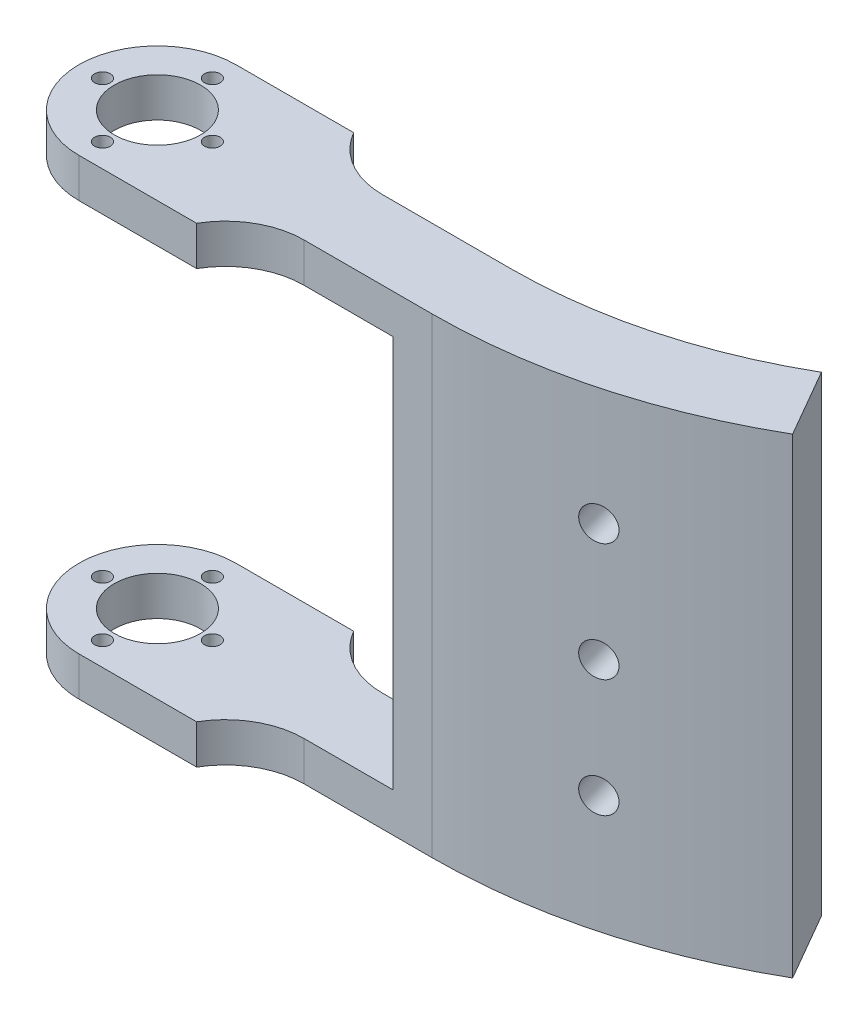
from build123d import *

# Parameters (mm, degrees)
BOSS_EXTRUDE2_DEPTH = 20
FILLET1_RADIUS      = 10
FILLET1_LENGTH      = 5
FILLET2_RADIUS      = 10
FILLET2_LENGTH      = 5
SKETCH5_R           = 1
SKETCH5_R_2         = 5.5
CUT_EXTRUDE5_DEPTH  = 69.007352544
CUT_EXTRUDE7_DEPTH  = 25
FILLET5_R           = 10
BOSS_EXTRUDE5_DEPTH = 60
SKETCH13_R          = 2.1
CUT_EXTRUDE8_DEPTH  = 60


with BuildPart() as part:
    # Sketch1 → Boss-Extrude2 (new body)
    with BuildSketch(Plane.XY):
        Polygon((-25, 30), (25, 30), (25, -30), (-25, -30), (-25, -25), (-20, -25), (20, -25), (20, 25), (-20, 25), (-25, 25), align=None)
    extrude(amount=BOSS_EXTRUDE2_DEPTH)

    # Fillet1: full round fillet: the end face becomes a half cylinder, R = half its width
    fillet1_face = Plane((-25, 27.5, 10), x_dir=(0, -1, 0), z_dir=(-1, 0, 0))  # on the end face: x along it, z out of the body
    fillet1_slab = fillet1_face.offset(-FILLET1_RADIUS / 2) * Box(FILLET1_LENGTH, 2 * FILLET1_RADIUS, FILLET1_RADIUS, mode=Mode.PRIVATE)  # the body's end, R deep
    fillet1_round = Plane((-15, 27.5, 10), x_dir=(-1, 0, 0), z_dir=(0, -1, 0)) * Cylinder(FILLET1_RADIUS, FILLET1_LENGTH, mode=Mode.PRIVATE)  # its axis R under the face
    add(fillet1_slab - fillet1_round, mode=Mode.SUBTRACT)

    # Fillet2: full round fillet: the end face becomes a half cylinder, R = half its width
    fillet2_face = Plane((-25, -27.5, 10), x_dir=(0, -1, 0), z_dir=(-1, 0, 0))  # on the end face: x along it, z out of the body
    fillet2_slab = fillet2_face.offset(-FILLET2_RADIUS / 2) * Box(FILLET2_LENGTH, 2 * FILLET2_RADIUS, FILLET2_RADIUS, mode=Mode.PRIVATE)  # the body's end, R deep
    fillet2_round = Plane((-15, -27.5, 10), x_dir=(-1, 0, 0), z_dir=(0, -1, 0)) * Cylinder(FILLET2_RADIUS, FILLET2_LENGTH, mode=Mode.PRIVATE)  # its axis R under the face
    add(fillet2_slab - fillet2_round, mode=Mode.SUBTRACT)

    # Sketch5 → Cut-Extrude5 (cut, through all)
    with BuildSketch(Plane(origin=(0, 30, 0), x_dir=(1, 0, 0), z_dir=(0, 1, 0))):
        with Locations(Location((-15, -3, 0), (0, 0, 180))):
            Circle(SKETCH5_R)
        with Locations(Location((-22, -10, 0), (0, 0, 180))):
            Circle(SKETCH5_R)
        with Locations(Location((-15, -17, 0), (0, 0, 180))):
            Circle(SKETCH5_R)
        with Locations(Location((-8, -10, 0), (0, 0, 180))):
            Circle(SKETCH5_R)
        with Locations(Location((-15, -10, 0), (0, 0, 180))):
            Circle(SKETCH5_R_2)
    extrude(amount=-CUT_EXTRUDE5_DEPTH, mode=Mode.SUBTRACT)

    # Sketch10 → Cut-Extrude7 (cut)
    with BuildSketch(Plane(origin=(25, 0, 0), x_dir=(0, 0, -1), z_dir=(1, 0, 0))):
        Polygon((-15, 28.180148829), (-15, -28.180148829), (-15, -30), (-20, -30), (-20, 30), (-15, 30), align=None)
        Polygon((-5, 28.180148829), (-5, -28.180148829), (-5, -30), (0, -30), (0, 30), (-5, 30), align=None)
    extrude(amount=-CUT_EXTRUDE7_DEPTH, mode=Mode.SUBTRACT)

    # Fillet5
    # the kernel refuses this fillet: 10 mm, written as the material it adds along each edge
    with BuildSketch(Plane(origin=(0, 25, 15), x_dir=(1, 0, 0), z_dir=(0, 1, 0)), Plane(origin=(0, -30, 15), x_dir=(1, 0, 0), z_dir=(0, 1, 0)), Plane(origin=(0, -25, 5), x_dir=(1, 0, 0), z_dir=(0, -1, 0))) as fillet5_piece_1:
        with BuildLine():
            CenterArc((8.660254038, -10), FILLET5_R, 90, 60)
            Line((0, -5), (-0.173205081, -4.9))
            ThreePointArc((-0.173205081, -4.9), (-0.2, -2.5), (-0.2, 0))
            Line((-0.2, 0), (0, 0.2))
            Line((0, 0.2), (8.660254038, 0.2))
            Line((8.660254038, 0.2), (8.660254038, 0))
        make_face()
    extrude(amount=5)
    with BuildSketch(Plane(origin=(0, 30, 5), x_dir=(0, 0, -1), z_dir=(0, -1, 0))) as fillet5_piece_2:
        with BuildLine():
            CenterArc((10, 8.660254038), FILLET5_R, 180, 60)
            Line((0, 8.660254038), (-0.2, 8.660254038))
            Line((-0.2, 8.660254038), (-0.2, 0))
            Line((-0.2, 0), (0, -0.2))
            ThreePointArc((0, -0.2), (2.5, -0.2), (4.9, -0.173205081))
            Line((4.9, -0.173205081), (5, 0))
        make_face()
    extrude(amount=5)

    # Sketch12 → Boss-Extrude5 (add)
    with BuildSketch(Plane.XZ.offset(30)):
        with BuildLine():
            Line((56.226298398, -3.359735054), (61.222506141, 5.302707337))
            ThreePointArc((61.222506141, 5.302707337), (43.74904955, 12.533728595), (25, 15))
            Line((25, 15), (25, 5))
            ThreePointArc((25, 5), (41.16297375, 2.873903962), (56.226298398, -3.359735054))
        make_face()
    extrude(amount=-BOSS_EXTRUDE5_DEPTH)

    # Sketch13 → Cut-Extrude8 (cut)
    with BuildSketch(Plane(origin=(2.920998947, 0, 10.910870277), x_dir=(-0.9659824633840055, 0, 0.2586075800021504), z_dir=(-0.2586075800021504, 0, -0.9659824633840055))):
        with Locations((-39.019497435, 15)):
            Circle(SKETCH13_R)
        with Locations((-39.019497435, 0)):
            Circle(SKETCH13_R)
        with Locations((-39.019497435, -15)):
            Circle(SKETCH13_R)
    extrude(amount=-CUT_EXTRUDE8_DEPTH, mode=Mode.SUBTRACT)


solid = part.part
